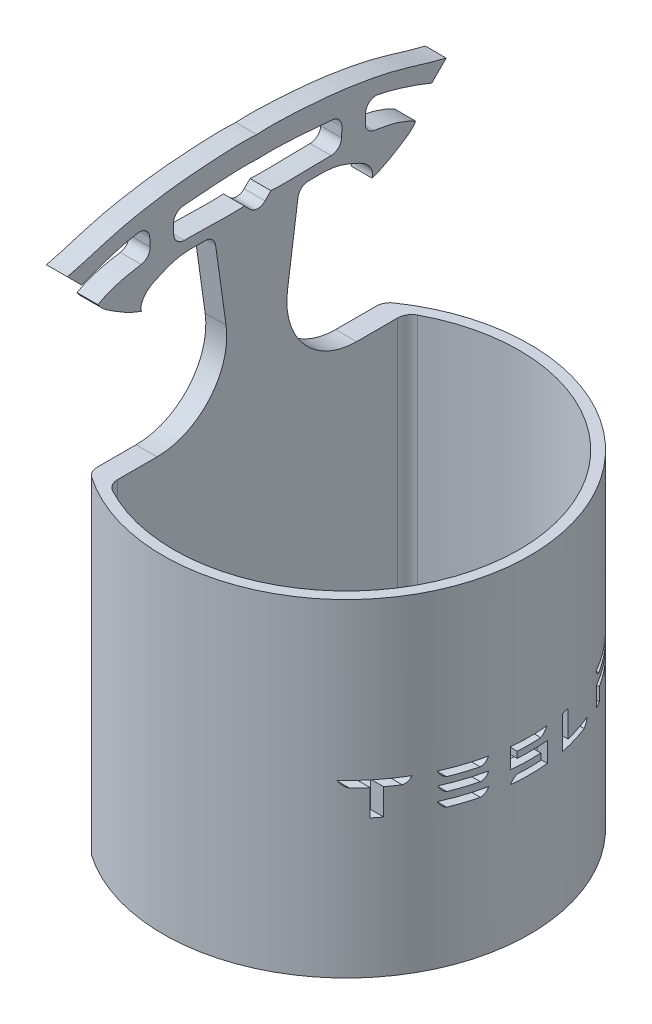
from build123d import *

# Parameters (mm, degrees)
BOSS_EXTRUDE2_DEPTH     = 90
BOSS_EXTRUDE3_START     = 4
BOSS_EXTRUDE3_DEPTH     = 4
BOSS_EXTRUDE4_DEPTH     = 6
CUT_EXTRUDE1_REACH      = 201.27
CUT_EXTRUDE1_END_RADIUS = 52.541666667
FILLET1_R               = 1
FILLET2_START           = -5
FILLET2_DEPTH           = 96
FILLET2_START_2         = -4
FILLET2_2_DEPTH         = 94
FILLET2_3_ANGLE         = 61.889064
FILLET2_4_ANGLE         = 61.889064
FILLET3_R               = 20
FILLET4_R               = 3


with BuildPart() as part:
    # Sketch3 → Boss-Extrude2 (new body)
    with BuildSketch(Plane(origin=(0, 0, 0), x_dir=(1, 0, 0), z_dir=(0, 1, 0))):
        with BuildLine():
            Line((-6, 84.583250825), (-6, 0.416749175))
            ThreePointArc((-6, 0.416749175), (78, 42.5), (-6, 84.583250825))
        make_face()
        with BuildLine():
            Line((0, 85), (0, 0))
            ThreePointArc((0, 0), (75, 42.5), (0, 85))
        make_face(mode=Mode.SUBTRACT)
    extrude(amount=BOSS_EXTRUDE2_DEPTH)

    # Sketch4 → Boss-Extrude3 (add)
    with BuildSketch(Plane.XZ.offset(BOSS_EXTRUDE3_START)):
        with BuildLine():
            Line((-6, -84.583250825), (-6, -0.416749175))
            ThreePointArc((-6, -0.416749175), (78, -42.5), (-6, -84.583250825))
        make_face()
    extrude(amount=-BOSS_EXTRUDE3_DEPTH)

    # Sketch2 → Boss-Extrude4 (add)
    with BuildSketch(Plane(origin=(0, 0, 0), x_dir=(0, 0, -1), z_dir=(1, 0, 0))):
        with BuildLine():
            add(Edge.make_bspline(
                [(30.075228294, 136.742118447), (26.414309489, 136.741388958), (20.700101258, 137.342522293), (14.399877595, 134.66509852), (10.230867883, 132.741147363), (8.724495285, 129.858872658), (9.189381987, 128.368963847)],
                knots=[0, 0, 0, 0, 0.451723584, 0.65771737, 0.820940174, 1, 1, 1, 1], degree=3))
            add(Edge.make_bspline(
                [(9.189381987, 128.368963847), (6.306613728, 129.322891058), (2.085687312, 131.815067758), (-2.252879706, 134.576230143), (-3.32330972, 136.271716504)],
                knots=[0, 0, 0, 0, 0.60076924, 1, 1, 1, 1], degree=3))
            add(Edge.make_bspline(
                [(-3.32330972, 136.271716504), (-1.126971956, 137.539786189), (3.008510183, 139.007413133), (8.169822211, 139.897405259), (10.848166421, 140.310483444), (11.72629668, 140.435100594)],
                knots=[0, 0, 0, 0, 0.17861204, 0.307237319, 0.369853816, 0.369853816, 0.369853816, 0.369853816], degree=3))
            Line((11.72629668, 140.435100594), (11.427570479, 148.846912883))
            add(Edge.make_bspline(
                [(-7.93324877, 143.425054266), (-3.928550498, 145.064306369), (2.433692145, 147.381403539), (9.061485543, 148.522459243), (11.427570479, 148.846912883)],
                knots=[0, 0, 0, 0, 0.254745088, 0.394856934, 0.394856934, 0.394856934, 0.394856934], degree=3))
            Line((-7.93324877, 143.425054266), (-12.072785876, 147.564591372))
            add(Edge.make_bspline(
                [(-12.072785876, 147.564591372), (-6.999721327, 148.763573561), (0.740487804, 151.538798671), (11.906777797, 153.681843627), (20.385542787, 154.940355811), (28.221979441, 155.451096083), (35.255400045, 155.942324091), (39.888222017, 155.882098146), (42.24955404, 155.749585195)],
                knots=[0, 0, 0, 0, 0.283210802, 0.444950622, 0.617006485, 0.748607666, 0.871480601, 1, 1, 1, 1], degree=3))
            add(Edge.make_bspline(
                [(96.571893956, 147.564591372), (91.498829408, 148.763573561), (83.758620277, 151.538798671), (72.592330284, 153.681843627), (64.113565293, 154.940355811), (56.27712864, 155.451096083), (49.243708036, 155.942324091), (44.610886063, 155.882098146), (42.24955404, 155.749585195)],
                knots=[0, 0, 0, 0, 0.283210802, 0.444950622, 0.617006485, 0.748607666, 0.871480601, 1, 1, 1, 1], degree=3))
            Line((96.571893956, 147.564591372), (92.43235685, 143.425054266))
            add(Edge.make_bspline(
                [(92.43235685, 143.425054266), (88.590089203, 145.064306369), (81.565397222, 147.381403539), (75.938514457, 148.522459243), (73.572429521, 148.846912883)],
                knots=[0, 0, 0, 0, 0.254745088, 0.394856934, 0.394856934, 0.394856934, 0.394856934], degree=3))
            Line((73.572429521, 148.846912883), (73.27370332, 140.435100594))
            add(Edge.make_bspline(
                [(87.8224178, 136.271716504), (85.532111074, 137.539786189), (81.774988463, 139.007413133), (75.836910203, 139.897405259), (74.151833579, 140.310483444), (73.27370332, 140.435100594)],
                knots=[0, 0, 0, 0, 0.17861204, 0.307237319, 0.369853816, 0.369853816, 0.369853816, 0.369853816], degree=3))
            add(Edge.make_bspline(
                [(75.309726094, 128.368963847), (78.192494352, 129.322891058), (82.413420768, 131.815067758), (86.751987786, 134.576230143), (87.8224178, 136.271716504)],
                knots=[0, 0, 0, 0, 0.60076924, 1, 1, 1, 1], degree=3))
            add(Edge.make_bspline(
                [(54.423879786, 136.742118447), (58.084798591, 136.741388958), (63.799006823, 137.342522293), (70.099230485, 134.66509852), (74.268240197, 132.741147363), (75.774612795, 129.858872658), (75.309726094, 128.368963847)],
                knots=[0, 0, 0, 0, 0.451723584, 0.65771737, 0.820940174, 1, 1, 1, 1], degree=3))
            Line((54.423879786, 136.742118447), (42.24955404, 50))
            Line((42.24955404, 50), (30.075228294, 136.742118447))
        make_face()
        with BuildLine():
            add(Edge.make_bspline(
                [(18.539241261, 139.781832154), (25.247143748, 140.100313997), (32.024711617, 139.405611), (38.698828854, 139.76749734)],
                knots=[0.525262213, 0.525262213, 0.525262213, 0.525262213, 1, 1, 1, 1], degree=3))
            Line((38.698828854, 139.76749734), (42.5, 135.966326194))
            Line((42.5, 135.966326194), (46.301171146, 139.76749734))
            add(Edge.make_bspline(
                [(66.460758739, 139.781832154), (59.752856253, 140.100313997), (52.975288383, 139.405611), (46.301171146, 139.76749734)],
                knots=[0.525262213, 0.525262213, 0.525262213, 0.525262213, 1, 1, 1, 1], degree=3))
            Line((66.460758739, 139.781832154), (66.748453868, 148.290619527))
            add(Edge.make_bspline(
                [(66.748453868, 148.290619527), (63.288353813, 148.6302317), (55.22740904, 149.309883811), (47.124626611, 149.802861515), (42.5, 149.555085988)],
                knots=[0.524188958, 0.524188958, 0.524188958, 0.524188958, 0.728211496, 1, 1, 1, 1], degree=3))
            add(Edge.make_bspline(
                [(18.251546132, 148.290619527), (21.711646187, 148.6302317), (29.77259096, 149.309883811), (37.875373389, 149.802861515), (42.5, 149.555085988)],
                knots=[0.524188958, 0.524188958, 0.524188958, 0.524188958, 0.728211496, 1, 1, 1, 1], degree=3))
            Line((18.251546132, 148.290619527), (18.539241261, 139.781832154))
        make_face(mode=Mode.SUBTRACT)
    extrude(amount=-BOSS_EXTRUDE4_DEPTH)

    # Cut-Extrude1: up to this cylinder (the profile starts inside it)
    cut_extrude1_end = Plane(origin=(25.458333333, 39.8952445, -42.5), z_dir=(0, -1, 0)) * Cylinder(CUT_EXTRUDE1_END_RADIUS, 517.142184333, mode=Mode.PRIVATE)
    # Sketch5 → Cut-Extrude1 (cut, up to the surface)
    with BuildSketch(Plane(origin=(0, 0, 0), x_dir=(0, 0, -1), z_dir=(1, 0, 0)), mode=Mode.PRIVATE) as cut_extrude1_sk1:
        with BuildLine():
            Line((4.023530161, 45.055318075), (15.938582794, 45.055318075))
            ThreePointArc((15.938582794, 45.055318075), (15.308920269, 43.895843687), (14.224388901, 43.144413408))
            Line((14.224388901, 43.144413408), (11.077016507, 43.144413408))
            Line((11.077016507, 43.144413408), (11.077016507, 35.613200894))
            Line((11.077016507, 35.613200894), (8.913197987, 35.613200894))
            Line((8.913197987, 35.613200894), (8.913197987, 43.144413408))
            Line((8.913197987, 43.144413408), (5.850130211, 43.144413408))
            ThreePointArc((5.850130211, 43.144413408), (4.724210687, 43.896626515), (4.023530161, 45.055318075))
        make_face()
    cut_extrude1_tool1 = extrude(cut_extrude1_sk1.sketch, amount=CUT_EXTRUDE1_REACH, mode=Mode.PRIVATE) & cut_extrude1_end
    add(cut_extrude1_tool1.solids().sort_by_distance((0, 42.032459, -10.002895))[0], mode=Mode.SUBTRACT)
    # Sketch5 → Cut-Extrude1 (cut, up to the surface)
    with BuildSketch(Plane(origin=(0, 0, 0), x_dir=(0, 0, -1), z_dir=(1, 0, 0)), mode=Mode.PRIVATE) as cut_extrude1_sk2:
        with BuildLine():
            Line((20.743946002, 45.055318075), (31.75974938, 45.055318075))
            ThreePointArc((31.75974938, 45.055318075), (31.071315232, 43.832847555), (29.848844712, 43.144413408))
            Line((29.848844712, 43.144413408), (22.570546052, 43.144413408))
            ThreePointArc((22.570546052, 43.144413408), (21.44935645, 43.901147764), (20.743946002, 45.055318075))
        make_face()
    cut_extrude1_tool2 = extrude(cut_extrude1_sk2.sketch, amount=CUT_EXTRUDE1_REACH, mode=Mode.PRIVATE) & cut_extrude1_end
    add(cut_extrude1_tool2.solids().sort_by_distance((0, 44.154584, -26.277686))[0], mode=Mode.SUBTRACT)
    # Sketch5 → Cut-Extrude1 (cut, up to the surface)
    with BuildSketch(Plane(origin=(0, 0, 0), x_dir=(0, 0, -1), z_dir=(1, 0, 0)), mode=Mode.PRIVATE) as cut_extrude1_sk3:
        with BuildLine():
            Line((47.665220583, 45.055318075), (37.295752608, 45.055318075))
            Line((37.295752608, 45.055318075), (37.295752608, 39.322604073))
            Line((37.295752608, 39.322604073), (45.782417455, 39.322604073))
            Line((45.782417455, 39.322604073), (45.782417455, 37.467902484))
            Line((45.782417455, 37.467902484), (39.03804804, 37.467902484))
            ThreePointArc((39.03804804, 37.467902484), (38.008860428, 36.689013409), (37.295752608, 35.613200894))
            Line((37.295752608, 35.613200894), (47.861931358, 35.613200894))
            Line((47.861931358, 35.613200894), (47.861931358, 41.345914897))
            Line((47.861931358, 41.345914897), (39.03804804, 41.345914897))
            Line((39.03804804, 41.345914897), (39.03804804, 43.144413408))
            Line((39.03804804, 43.144413408), (45.782417455, 43.144413408))
            ThreePointArc((45.782417455, 43.144413408), (46.890739447, 43.935400025), (47.665220583, 45.055318075))
        make_face()
    cut_extrude1_tool3 = extrude(cut_extrude1_sk3.sketch, amount=CUT_EXTRUDE1_REACH, mode=Mode.PRIVATE) & cut_extrude1_end
    add(cut_extrude1_tool3.solids().sort_by_distance((0, 40.309499, -42.583276))[0], mode=Mode.SUBTRACT)
    # Sketch5 → Cut-Extrude1 (cut, up to the surface)
    with BuildSketch(Plane(origin=(0, 0, 0), x_dir=(0, 0, -1), z_dir=(1, 0, 0)), mode=Mode.PRIVATE) as cut_extrude1_sk4:
        with BuildLine():
            Line((63.261574855, 37.467902484), (55.027823861, 37.467902484))
            Line((55.027823861, 37.467902484), (55.027823861, 45.055318075))
            Line((55.027823861, 45.055318075), (52.920208419, 45.055318075))
            Line((52.920208419, 45.055318075), (52.920208419, 35.613200894))
            Line((52.920208419, 35.613200894), (61.800294815, 35.613200894))
            ThreePointArc((61.800294815, 35.613200894), (62.703261945, 36.404778814), (63.261574855, 37.467902484))
        make_face()
    cut_extrude1_tool4 = extrude(cut_extrude1_sk4.sketch, amount=CUT_EXTRUDE1_REACH, mode=Mode.PRIVATE) & cut_extrude1_end
    add(cut_extrude1_tool4.solids().sort_by_distance((0, 37.327868, -59.144699))[0], mode=Mode.SUBTRACT)
    # Sketch5 → Cut-Extrude1 (cut, up to the surface)
    with BuildSketch(Plane(origin=(0, 0, 0), x_dir=(0, 0, -1), z_dir=(1, 0, 0)), mode=Mode.PRIVATE) as cut_extrude1_sk5:
        with BuildLine():
            Line((68.404156534, 45.055318075), (79.448061451, 45.055318075))
            ThreePointArc((79.448061451, 45.055318075), (78.699439348, 43.973331739), (77.677664479, 43.144413408))
            Line((77.677664479, 43.144413408), (70.230756584, 43.144413408))
            ThreePointArc((70.230756584, 43.144413408), (69.069334013, 43.862689779), (68.404156534, 45.055318075))
        make_face()
    cut_extrude1_tool5 = extrude(cut_extrude1_sk5.sketch, amount=CUT_EXTRUDE1_REACH, mode=Mode.PRIVATE) & cut_extrude1_end
    add(cut_extrude1_tool5.solids().sort_by_distance((0, 44.15467, -73.865317))[0], mode=Mode.SUBTRACT)
    # Sketch5 → Cut-Extrude1 (cut, up to the surface)
    with BuildSketch(Plane(origin=(0, 0, 0), x_dir=(0, 0, -1), z_dir=(1, 0, 0)), mode=Mode.PRIVATE) as cut_extrude1_sk6:
        Polygon((77.424750626, 35.41649012), (79.279452216, 35.613200894), (79.279452216, 41.345914897), (68.657070387, 41.345914897), (68.657070387, 35.613200894), (70.624178133, 35.613200894), (70.624178133, 39.322604073), (77.424750626, 39.322604073), align=None)
    cut_extrude1_tool6 = extrude(cut_extrude1_sk6.sketch, amount=CUT_EXTRUDE1_REACH, mode=Mode.PRIVATE) & cut_extrude1_end
    add(cut_extrude1_tool6.solids().sort_by_distance((0, 35.635819, -78.339271))[0], mode=Mode.SUBTRACT)
    # Sketch5 → Cut-Extrude1 (cut, up to the surface)
    with BuildSketch(Plane(origin=(0, 0, 0), x_dir=(0, 0, -1), z_dir=(1, 0, 0)), mode=Mode.PRIVATE) as cut_extrude1_sk7:
        with BuildLine():
            Line((20.80014908, 41.345914897), (31.815952458, 41.345914897))
            ThreePointArc((31.815952458, 41.345914897), (31.127518311, 40.123444377), (29.905047791, 39.43501023))
            Line((29.905047791, 39.43501023), (22.62674913, 39.43501023))
            ThreePointArc((22.62674913, 39.43501023), (21.505559528, 40.191744586), (20.80014908, 41.345914897))
        make_face()
    cut_extrude1_tool7 = extrude(cut_extrude1_sk7.sketch, amount=CUT_EXTRUDE1_REACH, mode=Mode.PRIVATE) & cut_extrude1_end
    add(cut_extrude1_tool7.solids().sort_by_distance((0, 40.445181, -26.333889))[0], mode=Mode.SUBTRACT)
    # Sketch5 → Cut-Extrude1 (cut, up to the surface)
    with BuildSketch(Plane(origin=(0, 0, 0), x_dir=(0, 0, -1), z_dir=(1, 0, 0)), mode=Mode.PRIVATE) as cut_extrude1_sk8:
        with BuildLine():
            Line((20.772047541, 37.467902484), (31.787850919, 37.467902484))
            ThreePointArc((31.787850919, 37.467902484), (31.099416771, 36.245431964), (29.876946251, 35.556997816))
            Line((29.876946251, 35.556997816), (22.598647591, 35.556997816))
            ThreePointArc((22.598647591, 35.556997816), (21.477457989, 36.313732172), (20.772047541, 37.467902484))
        make_face()
    cut_extrude1_tool8 = extrude(cut_extrude1_sk8.sketch, amount=CUT_EXTRUDE1_REACH, mode=Mode.PRIVATE) & cut_extrude1_end
    add(cut_extrude1_tool8.solids().sort_by_distance((0, 36.567168, -26.305788))[0], mode=Mode.SUBTRACT)

    # Fillet1
    fillet1_edges = [part.edges().sort_by_distance(p)[0] for p in [
        (75, 0, -42.5),
        (0, 0, -42.5),
    ]]
    fillet(fillet1_edges, radius=FILLET1_R)

    # Fillet2: read off the stored shape, not the designer's step
    # Fillet2 outline → Fillet2 (cut)
    with BuildSketch(Plane(origin=(0, 0, 0), x_dir=(1, 0, 0), z_dir=(0, 1, 0)).offset(FILLET2_START)):
        with BuildLine():
            ThreePointArc((-6, 0.416749175), (-5.137658114, -0.214307246), (-4.262660944, -0.827695938))
            ThreePointArc((-4.262660944, -0.827695938), (-5.53911315, 0.60679511), (-6, 2.470843959))
            Line((-6, 2.470843959), (-6, 0.416749175))
        make_face()
        with BuildLine():
            ThreePointArc((-6, 82.529156041), (-5.53911315, 84.39320489), (-4.262660944, 85.827695938))
            ThreePointArc((-4.262660944, 85.827695938), (-5.137658114, 85.214307246), (-6, 84.583250825))
            Line((-6, 84.583250825), (-6, 82.529156041))
        make_face()
    extrude(amount=FILLET2_DEPTH, mode=Mode.SUBTRACT)

    # Fillet2 2 outline → Fillet2 2 (add)
    with BuildSketch(Plane(origin=(0, 0, 0), x_dir=(1, 0, 0), z_dir=(0, 1, 0)).offset(FILLET2_START_2)):
        with BuildLine():
            ThreePointArc((0, 0), (1.050293506, -0.611765539), (2.115279048, -1.197580628))
            ThreePointArc((2.115279048, -1.197580628), (0.569337979, 0.273735123), (0, 2.330567177))
            Line((0, 2.330567177), (0, 0))
        make_face()
        with BuildLine():
            ThreePointArc((0, 82.669432823), (0.569337979, 84.726264877), (2.115279048, 86.197580628))
            ThreePointArc((2.115279048, 86.197580628), (1.050293506, 85.611765539), (0, 85))
            Line((0, 85), (0, 82.669432823))
        make_face()
    extrude(amount=FILLET2_2_DEPTH)

    # Fillet2 3 outline → Fillet2 3 (revolve)
    with BuildSketch(Plane(origin=(4, 0, -2.330567177), x_dir=(-1, 0, 0), z_dir=(0, 0, -1))):
        with BuildLine():
            Line((4, 0), (4, 1))
            ThreePointArc((4, 1), (3.707106781, 0.292893219), (3, 0))
            Line((3, 0), (4, 0))
        make_face()
    revolve(axis=Axis((4, 0, -2.330567177), (0, 1, 0)), revolution_arc=FILLET2_3_ANGLE)

    # Fillet2 4 outline → Fillet2 4 (revolve)
    with BuildSketch(Plane(origin=(4, 0, -82.669432823), x_dir=(-0.4711802378774044, 0, -0.8820369512859383), z_dir=(0.8820369512859383, 0, -0.4711802378774044))):
        with BuildLine():
            Line((4, 0), (4, 1))
            ThreePointArc((4, 1), (3.707106781, 0.292893219), (3, 0))
            Line((3, 0), (4, 0))
        make_face()
    revolve(axis=Axis((4, 0, -82.669432823), (0, 1, 0)), revolution_arc=FILLET2_4_ANGLE)

    # Fillet3
    fillet3_edges = [part.edges().sort_by_distance(p)[0] for p in [
        (-3, 90, -47.863586053),
        (-3, 90, -36.635522027),
    ]]
    fillet(fillet3_edges, radius=FILLET3_R)

    # Fillet4
    fillet4_edges = [part.edges().sort_by_distance(p)[0] for p in [
        (-3, 148.846912883, -73.572429521),
        (-3, 140.435100594, -73.27370332),
        (-3, 148.846912883, -11.427570479),
        (-3, 140.435100594, -11.72629668),
        (-3, 148.290619527, -18.251546132),
        (-3, 139.781832154, -18.539241261),
        (-3, 148.290619527, -66.748453868),
        (-3, 139.781832154, -66.460758739),
        (-3, 135.966326194, -42.5),
        (-3, 136.742118447, -54.423879786),
        (-3, 136.742118447, -30.075228294),
    ]]
    fillet(fillet4_edges, radius=FILLET4_R)


solid = part.part
